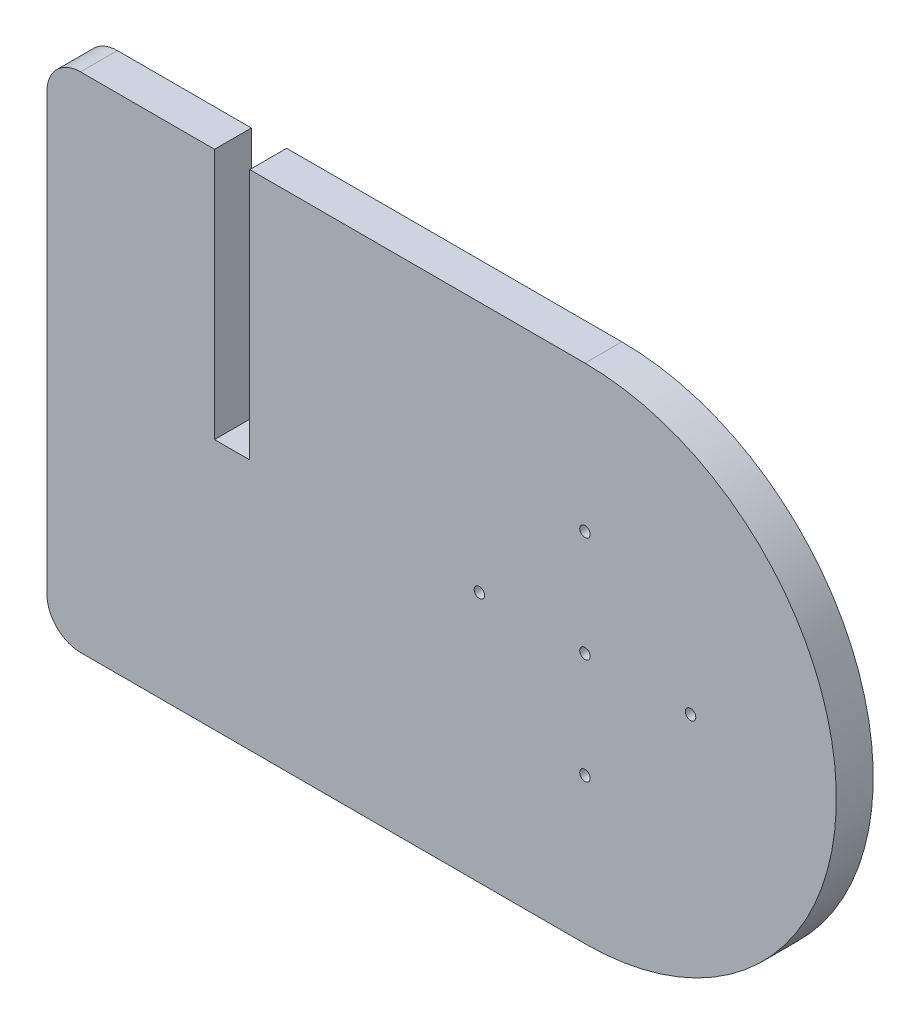
from build123d import *

# Parameters (mm, degrees)
SKETCH1_R           = 0.396875
BOSS_EXTRUDE1_DEPTH = 2.794
FILLET1_R           = 2.54


with BuildPart() as part:
    # Sketch1 → Boss-Extrude1 (new body)
    with BuildSketch(Plane.XY):
        with BuildLine():
            Line((-0.378072382, 19.05), (25.021927618, 19.05))
            ThreePointArc((25.021927618, 19.05), (44.071927618, 0), (25.021927618, -19.05))
            Line((25.021927618, -19.05), (-15.745072382, -19.05))
            Line((-15.745072382, -19.05), (-15.745072382, -9.525))
            Line((-15.745072382, -9.525), (-15.745072382, 19.05))
            Line((-15.745072382, 19.05), (-3.045072382, 19.05))
            Line((-3.045072382, 19.05), (-3.045072382, 0))
            Line((-3.045072382, 0), (-0.378072382, 0))
            Line((-0.378072382, 0), (-0.378072382, 19.05))
        make_face()
        with Locations((25.021927618, 8)):
            Circle(SKETCH1_R, mode=Mode.SUBTRACT)
        with Locations((25.021927618, 0)):
            Circle(SKETCH1_R, mode=Mode.SUBTRACT)
        with Locations((33.021927618, 0)):
            Circle(SKETCH1_R, mode=Mode.SUBTRACT)
        with Locations((25.021927618, -8)):
            Circle(SKETCH1_R, mode=Mode.SUBTRACT)
        with Locations((17.021927618, 0)):
            Circle(SKETCH1_R, mode=Mode.SUBTRACT)
    extrude(amount=BOSS_EXTRUDE1_DEPTH)

    # Fillet1
    fillet1_edges = [part.edges().sort_by_distance(p)[0] for p in [
        (-15.745072382, -19.05, 1.397),
        (-15.745072382, 19.05, 1.397),
    ]]
    fillet(fillet1_edges, radius=FILLET1_R)


solid = part.part
